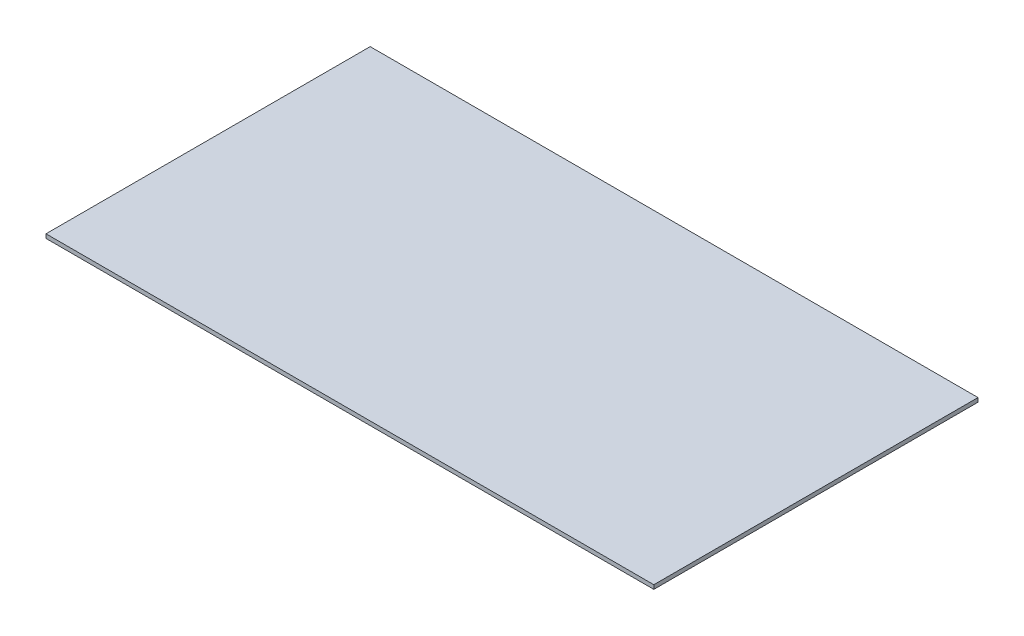
from build123d import *

# Parameters (mm, degrees)
SKETCH_1_W      = 1500
SKETCH_1_H      = 800
EXTRUDE_1_DEPTH = 10


with BuildPart() as part:
    # Эскиз1 → Бобышка-Вытянуть1 (new body)
    with BuildSketch(Plane(origin=(0, 0, 0), x_dir=(1, 0, 0), z_dir=(0, 1, 0))):
        Rectangle(SKETCH_1_W, SKETCH_1_H)
    extrude(amount=EXTRUDE_1_DEPTH)


solid = part.part
